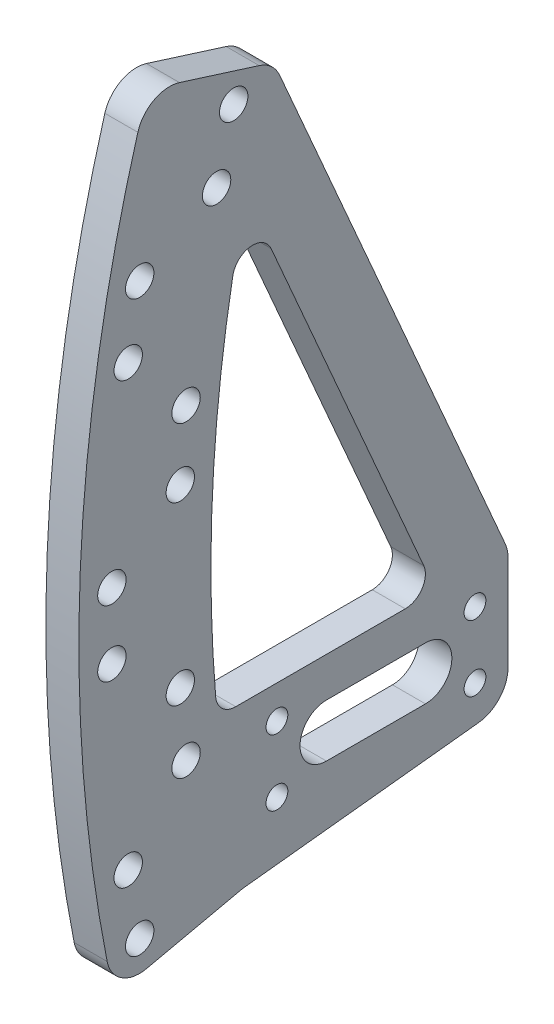
from build123d import *

# Parameters (mm, degrees)
SKETCH_1_R      = 2.15
SKETCH_1_R_2    = 1.65
EXTRUDE_1_DEPTH = 5
FILLET_1_R      = 5
FILLET_2_R      = 3.05


with BuildPart() as part:
    # ｽｹｯﾁ1 → ﾎﾞｽ - 押し出し1 (new body)
    with BuildSketch(Plane(origin=(0, 0, 0), x_dir=(0, 0, -1), z_dir=(1, 0, 0))):
        with BuildLine():
            ThreePointArc((-219.666601602, 48.698913136), (-225, 0), (-219.666601602, -48.698913136))
            Line((-219.666601602, -48.698913136), (-200.14068146, -44.370120857))
            Line((-200.14068146, -44.370120857), (-160, -40))
            Line((-160, -40), (-160, -20))
            Line((-160, -20), (-195.511974903, 61.644688898))
            Line((-195.511974903, 61.644688898), (-214.586313918, 67.658804888))
            ThreePointArc((-214.586313918, 67.658804888), (-217.333310915, 58.234285148), (-219.666601602, 48.698913136))
        make_face()
        with Locations((-215.789464774, -43.126637852)):
            Circle(SKETCH_1_R, mode=Mode.SUBTRACT)
        with Locations((-217.525946551, -33.278560322)):
            Circle(SKETCH_1_R, mode=Mode.SUBTRACT)
        with Locations((-208.765107886, -23.283679467)):
            Circle(SKETCH_1_R, mode=Mode.SUBTRACT)
        with Locations((-195, -35)):
            Circle(SKETCH_1_R_2, mode=Mode.SUBTRACT)
        with Locations((-195, -25)):
            Circle(SKETCH_1_R_2, mode=Mode.SUBTRACT)
        with Locations((-209.636665313, -13.321732487)):
            Circle(SKETCH_1_R, mode=Mode.SUBTRACT)
        with Locations((-220, -5)):
            Circle(SKETCH_1_R, mode=Mode.SUBTRACT)
        with Locations((-220, 5)):
            Circle(SKETCH_1_R, mode=Mode.SUBTRACT)
        with BuildLine():
            ThreePointArc((-187.5, -34), (-191.5, -30), (-187.5, -26))
            Line((-187.5, -26), (-172.5, -26))
            ThreePointArc((-172.5, -26), (-168.5, -30), (-172.5, -34))
            Line((-172.5, -34), (-187.5, -34))
        make_face(mode=Mode.SUBTRACT)
        with Locations((-165, -35)):
            Circle(SKETCH_1_R_2, mode=Mode.SUBTRACT)
        with Locations((-165, -25)):
            Circle(SKETCH_1_R_2, mode=Mode.SUBTRACT)
        with Locations((-209.636665313, 13.321732487)):
            Circle(SKETCH_1_R, mode=Mode.SUBTRACT)
        with Locations((-208.765107886, 23.283679467)):
            Circle(SKETCH_1_R, mode=Mode.SUBTRACT)
        with Locations((-217.525946551, 33.278560322)):
            Circle(SKETCH_1_R, mode=Mode.SUBTRACT)
        with Locations((-215.789464774, 43.126637852)):
            Circle(SKETCH_1_R, mode=Mode.SUBTRACT)
        with Locations((-204.138518746, 49.52237034)):
            Circle(SKETCH_1_R, mode=Mode.SUBTRACT)
        with Locations((-201.550328295, 59.181628603)):
            Circle(SKETCH_1_R, mode=Mode.SUBTRACT)
        with BuildLine():
            Line((-170.904990057, -20), (-204.022057631, -20))
            ThreePointArc((-204.022057631, -20), (-204.568385698, 13.295697527), (-199.716824856, 46.240565194))
            Line((-199.716824856, 46.240565194), (-170.904990057, -20))
        make_face(mode=Mode.SUBTRACT)
    extrude(amount=EXTRUDE_1_DEPTH)

    # ﾌｨﾚｯﾄ1
    fillet_1_edges = [part.edges().sort_by_distance(p)[0] for p in [
        (2.5, -44.370120857, 200.14068146),
        (2.5, -48.698913136, 219.666601602),
        (2.5, -40, 160),
        (2.5, 67.658804888, 214.586313918),
        (2.5, 61.644688898, 195.511974903),
        (2.5, -20, 160),
    ]]
    fillet(fillet_1_edges, radius=FILLET_1_R)

    # ﾌｨﾚｯﾄ2
    fillet_2_edges = [part.edges().sort_by_distance(p)[0] for p in [
        (2.5, -20, 204.022057631),
        (2.5, 46.240565194, 199.716824856),
        (2.5, -20, 170.904990057),
    ]]
    fillet(fillet_2_edges, radius=FILLET_2_R)


solid = part.part
